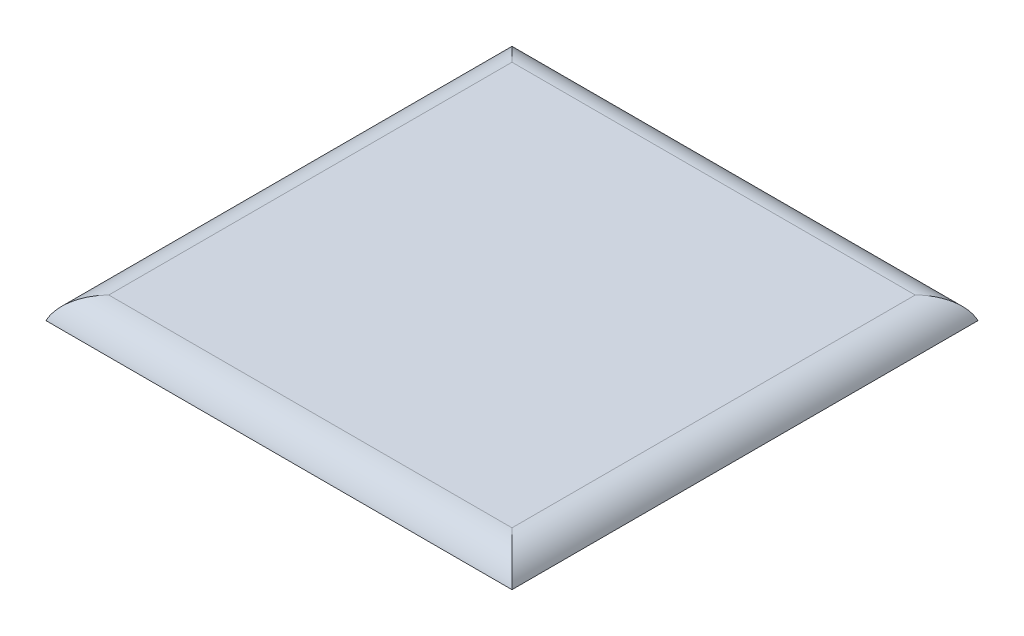
from build123d import *

# Parameters (mm, degrees)
SKETCH1_W           = 184.621276595
SKETCH1_H           = 188.910638298
BOSS_EXTRUDE1_DEPTH = 10
FILLET2_R           = 15


with BuildPart() as part:
    # Sketch1 → Boss-Extrude1 (new body)
    with BuildSketch(Plane(origin=(0, 0, 0), x_dir=(1, 0, 0), z_dir=(0, 1, 0))):
        Polygon((-75.778723404, 119.565957447), (108.842553191, 119.565957447), (121.531914894, 130.110638298), (-88.468085106, 130.110638298), align=None)
        Polygon((108.842553191, 119.565957447), (108.842553191, -69.344680851), (121.531914894, -79.889361702), (121.531914894, 130.110638298), align=None)
        Polygon((108.842553191, -69.344680851), (121.531914894, -79.889361702), (-88.468085106, -79.889361702), (-88.468085106, 130.110638298), (-75.778723404, 119.565957447), (-75.778723404, -69.344680851), align=None)
        with Locations((16.531914894, 25.110638298)):
            Rectangle(SKETCH1_W, SKETCH1_H)
    extrude(amount=BOSS_EXTRUDE1_DEPTH)

    # Fillet2
    # the kernel refuses this fillet: 15 mm, written as the material it takes off along each edge
    with BuildSketch(Plane(origin=(121.531914894, 10, 115.244700761), x_dir=(0, -1, 0), z_dir=(0, 0, -1)), Plane(origin=(156.887253953, 10, -130.110638298), x_dir=(0, -1, 0), z_dir=(-1, 0, 0))) as fillet2_piece_1:
        with BuildLine():
            CenterArc((15, 14.142135624), FILLET2_R, 180, 70.528779366)
            Line((0, 14.142135624), (-0.3, 14.142135624))
            Line((-0.3, 14.142135624), (-0.3, 0))
            Line((-0.3, 0), (0, -0.3))
            ThreePointArc((0, -0.3), (5, -0.3), (9.9, -0.282842712))
            Line((9.9, -0.282842712), (10, 0))
        make_face()
    extrude(amount=280.710678119, mode=Mode.SUBTRACT)
    with BuildSketch(Plane(origin=(-88.468085106, 10, 115.244700761), x_dir=(0, -1, 0), z_dir=(0, 0, -1)), Plane(origin=(156.887253953, 10, 79.889361702), x_dir=(0, -1, 0), z_dir=(-1, 0, 0))) as fillet2_piece_2:
        with BuildLine():
            CenterArc((15, -14.142135624), FILLET2_R, 109.471220634, 70.528779366)
            Line((0, -14.142135624), (-0.3, -14.142135624))
            Line((-0.3, -14.142135624), (-0.3, 0))
            Line((-0.3, 0), (0, 0.3))
            ThreePointArc((0, 0.3), (5, 0.3), (9.9, 0.282842712))
            Line((9.9, 0.282842712), (10, 0))
        make_face()
    extrude(amount=280.710678119, mode=Mode.SUBTRACT)


solid = part.part
